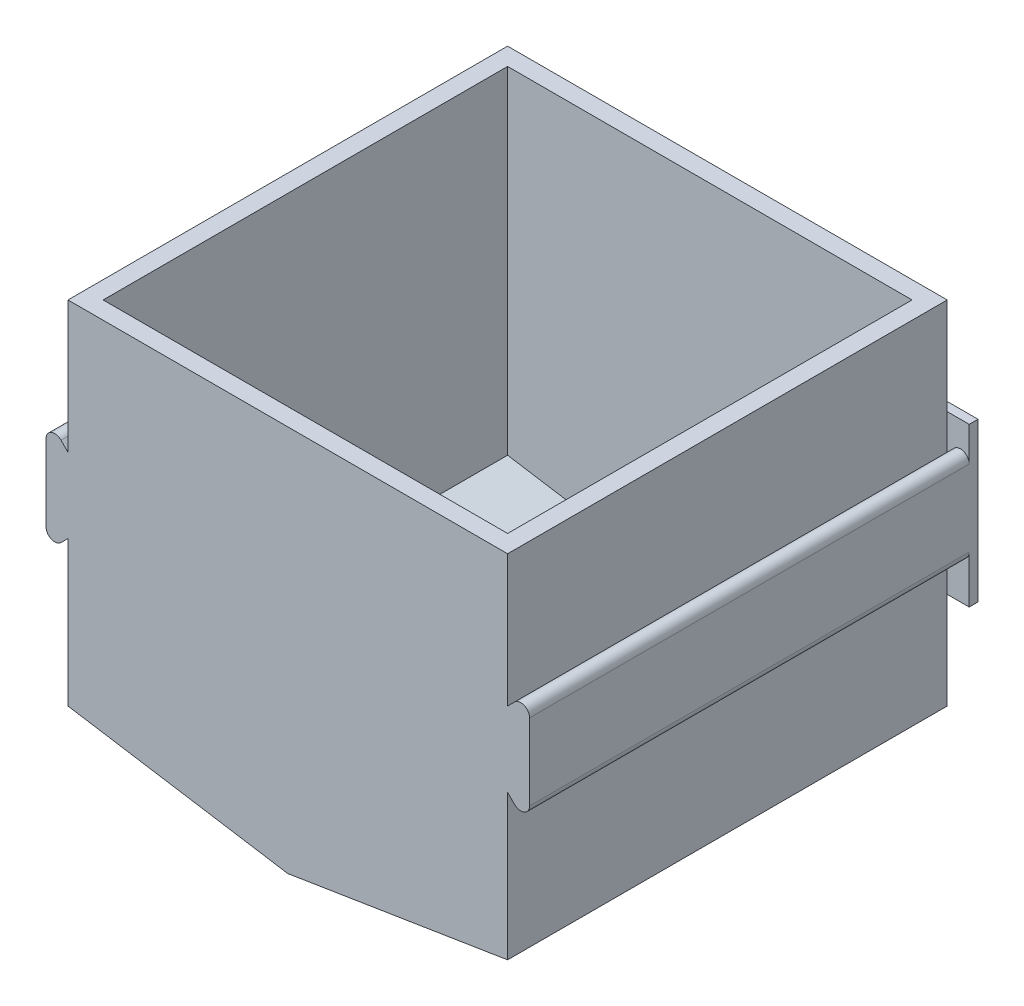
from build123d import *

# Parameters (mm, degrees)
EXTRUDE_1_DEPTH = 50
EXTRUDE_4_DEPTH = 50
SHELL_START     = 2
SHELL_1_DEPTH   = 46
SKETCH_4_W      = 55
SKETCH_4_H      = 18
EXTRUDE_5_DEPTH = 1
SKETCH_5_W      = 8
SKETCH_5_H      = 4
EXTRUDE_6_DEPTH = 5
FILLET_1_R      = 1


# Read off the part's stored shape, not the designer's step: 抽壳1
with BuildPart() as part:
    # 草图2 → 凸台-拉伸1 (new body)
    with BuildSketch(Plane.XY):
        Polygon((-25, -20), (0, -24), (25, -20), (25, 20), (-25, 20), align=None)
    extrude(amount=EXTRUDE_1_DEPTH)

    # 草图3 → 凸台-拉伸4 (add)
    with BuildSketch(Plane.XY):
        Polygon((-25, 5), (-27.5, 7.5), (-27.5, -6), (-25, -3.5), align=None)
        Polygon((27.5, -6), (25, -3.5), (25, 5), (27.5, 7.5), align=None)
    extrude(amount=EXTRUDE_4_DEPTH)

    # 抽壳1 outline → 抽壳1 (cut)
    with BuildSketch(Plane.XY.offset(SHELL_START)):
        Polygon((23, -18.294561776), (23, 20), (-23, 20), (-23, -18.294561776), (0, -21.974561776), align=None)
        Polygon((-25.5, -1.171572875), (-23.578427125, 0.75), (-25.5, 2.671572875), align=None)
        Polygon((23.578427125, 0.75), (25.5, -1.171572875), (25.5, 2.671572875), align=None)
    extrude(amount=SHELL_1_DEPTH, mode=Mode.SUBTRACT)

    # 草图4 → 凸台-拉伸5 (add)
    with BuildSketch(Plane(origin=(0, 0, 0), x_dir=(-1, 0, 0), z_dir=(0, 0, -1))):
        Rectangle(SKETCH_4_W, SKETCH_4_H)
    extrude(amount=EXTRUDE_5_DEPTH)

    # 草图5 → 凸台-拉伸6 (add)
    with BuildSketch(Plane.XY):
        Rectangle(SKETCH_5_W, SKETCH_5_H)
    extrude(amount=-EXTRUDE_6_DEPTH)

    # 圆角1
    fillet_1_edges = [part.edges().sort_by_distance(p)[0] for p in [
        (-27.5, 7.5, 25),
        (-27.5, -6, 25),
        (27.5, -6, 25),
        (27.5, 7.5, 25),
    ]]
    fillet(fillet_1_edges, radius=FILLET_1_R)


solid = part.part
